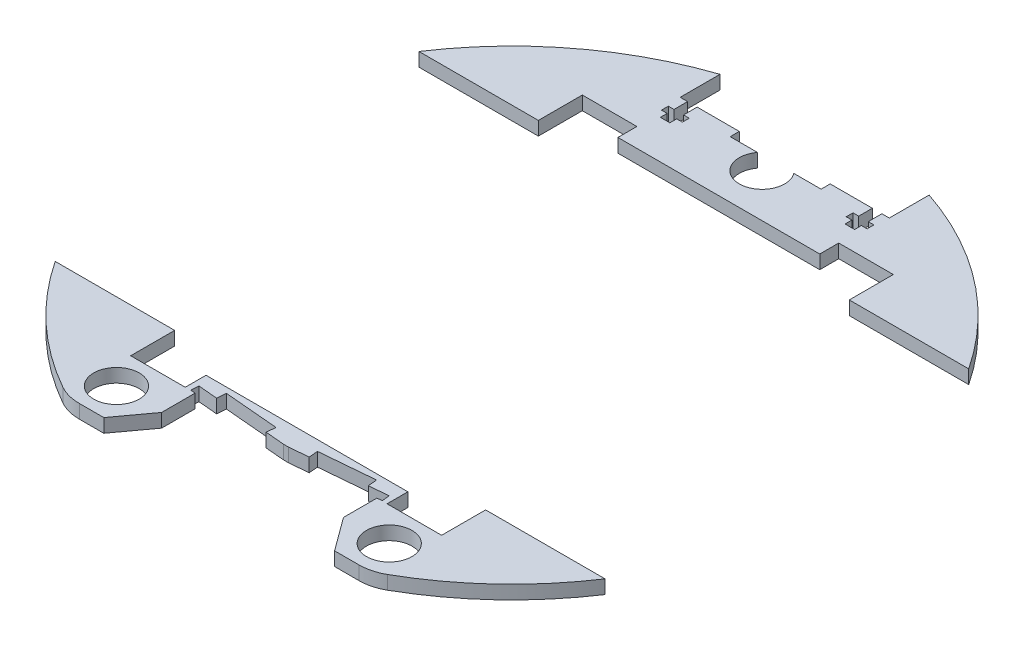
from build123d import *

# Parameters (mm, degrees)
BOSS_EXTRUDE1_DEPTH = 3
CUT_EXTRUDE1_DEPTH  = 103.574363269
SKETCH3_W           = 38.3
SKETCH3_H           = 80
CUT_EXTRUDE2_DEPTH  = 103.574363269
CUT_EXTRUDE3_DEPTH  = 95.453692358
SKETCH5_W           = 40
SKETCH5_H           = 14.693066202
CUT_EXTRUDE4_DEPTH  = 95.453692358
CUT_EXTRUDE5_DEPTH  = 95.453692358
SKETCH7_R           = 5
CUT_EXTRUDE6_DEPTH  = 92.610588908
SKETCH9_W           = 4.6
SKETCH9_H           = 1.5
CUT_EXTRUDE8_DEPTH  = 92.610588908
SKETCH10_W          = 2.1
SKETCH10_H          = 3
SKETCH10_H_2        = 1.5
CUT_EXTRUDE9_DEPTH  = 92.610588908
SKETCH11_R          = 5
CUT_EXTRUDE10_DEPTH = 92.610588908
CUT_EXTRUDE11_DEPTH = 92.610588908


with BuildPart() as part:
    # Sketch1 → Boss-Extrude1 (new body)
    with BuildSketch(Plane(origin=(0, 0, 0), x_dir=(1, 0, 0), z_dir=(0, 1, 0))):
        with BuildLine():
            Line((-30.763446914, -64.404598464), (30.763446914, -64.404598464))
            ThreePointArc((30.763446914, -64.404598464), (33.308308644, -64.075362589), (35.68559842, -63.109334218))
            ThreePointArc((35.68559842, -63.109334218), (0, 72.5), (-35.68559842, -63.109334218))
            ThreePointArc((-35.68559842, -63.109334218), (-33.308308644, -64.075362589), (-30.763446914, -64.404598464))
        make_face()
    extrude(amount=BOSS_EXTRUDE1_DEPTH)

    # Sketch2 → Cut-Extrude1 (cut, through all)
    with BuildSketch(Plane(origin=(0, 3, 0), x_dir=(1, 0, 0), z_dir=(0, 1, 0))):
        Polygon((22.2, -45.1), (22.2, -49.675685802), (34.2, -49.675685802), (34.2, 49.675685802), (22.2, 49.675685802), (22.2, 45.5), (-22.2, 45.5), (-22.2, 49.675685802), (-34.2, 49.675685802), (-34.2, -49.675685802), (-22.2, -49.675685802), (-22.2, -45.1), align=None)
    extrude(amount=-CUT_EXTRUDE1_DEPTH, mode=Mode.SUBTRACT)

    # Sketch3 → Cut-Extrude2 (cut, through all)
    with BuildSketch(Plane(origin=(0, 3, 0), x_dir=(1, 0, 0), z_dir=(0, 1, 0))):
        with Locations((-53.35, 0)):
            Rectangle(SKETCH3_W, SKETCH3_H)
        with Locations((53.35, 0)):
            Rectangle(SKETCH3_W, SKETCH3_H)
    extrude(amount=-CUT_EXTRUDE2_DEPTH, mode=Mode.SUBTRACT)


with BuildPart() as cut_extrude2_piece_1:
    # of the separate pieces the step leaves, piece 1, a body of its own (cut_extrude2_pieces)
    add(part.part.solids().sort_by_distance((60.466933112, 0, -40))[0])

    # Sketch6 → Cut-Extrude5 (cut, through all)
    with BuildSketch(Plane(origin=(0, 3, 0), x_dir=(1, 0, 0), z_dir=(0, 1, 0))):
        Polygon((-23, 72.5), (23, 72.5), (23, 60), (10, 60), (10, 58), (-10, 58), (-10, 60), (-23, 60), align=None)
    extrude(amount=-CUT_EXTRUDE5_DEPTH, mode=Mode.SUBTRACT)

    # Sketch9 → Cut-Extrude8 (cut, through all)
    with BuildSketch(Plane(origin=(0, 3, 0), x_dir=(1, 0, 0), z_dir=(0, 1, 0))):
        with Locations((20.32, 56.25)):
            Rectangle(SKETCH9_W, SKETCH9_H)
        with Locations((-20.32, 56.25)):
            Rectangle(SKETCH9_W, SKETCH9_H)
    extrude(amount=-CUT_EXTRUDE8_DEPTH, mode=Mode.SUBTRACT)

    # Sketch10 → Cut-Extrude9 (cut, through all)
    with BuildSketch(Plane(origin=(0, 3, 0), x_dir=(1, 0, 0), z_dir=(0, 1, 0))):
        with Locations((20.32, 58.5)):
            Rectangle(SKETCH10_W, SKETCH10_H)
        with Locations((20.32, 54.75)):
            Rectangle(SKETCH10_W, SKETCH10_H_2)
        with Locations((-20.32, 54.75)):
            Rectangle(SKETCH10_W, SKETCH10_H_2)
        with Locations((-20.32, 58.5)):
            Rectangle(SKETCH10_W, SKETCH10_H)
    extrude(amount=-CUT_EXTRUDE9_DEPTH, mode=Mode.SUBTRACT)

    # Sketch11 → Cut-Extrude10 (cut, through all)
    with BuildSketch(Plane(origin=(0, 3, 0), x_dir=(1, 0, 0), z_dir=(0, 1, 0))):
        with Locations((0, 55)):
            Circle(SKETCH11_R)
    extrude(amount=-CUT_EXTRUDE10_DEPTH, mode=Mode.SUBTRACT)


with BuildPart() as cut_extrude2_piece_2:
    # of the separate pieces the step leaves, piece 2, a body of its own (cut_extrude2_pieces)
    add(part.part.solids().sort_by_distance((-35.68559842, 0, 63.109334218))[0])

    # Sketch4 → Cut-Extrude3 (cut, through all)
    with BuildSketch(Plane(origin=(0, 3, 0), x_dir=(1, 0, 0), z_dir=(0, 1, 0))):
        Polygon((-21.070156074, -49.617905737), (-0.648164763, -51.404598464), (-0.5, -49.711067477), (-20.921991311, -47.924374751), align=None)
        Polygon((21.070156074, -49.617905737), (20.921991311, -47.924374751), (0.5, -49.711067477), (0.648164763, -51.404598464), align=None)
    extrude(amount=-CUT_EXTRUDE3_DEPTH, mode=Mode.SUBTRACT)

    # Sketch5 → Cut-Extrude4 (cut, through all)
    with BuildSketch(Plane(origin=(0, 3, 0), x_dir=(1, 0, 0), z_dir=(0, 1, 0))):
        with Locations((0, -57.058065363)):
            Rectangle(SKETCH5_W, SKETCH5_H)
        Polygon((16.688163844, -48.294786657), (4.733827467, -49.34065557), (4.559515981, -47.348266174), (16.513852358, -46.302397261), align=None)
        Polygon((-16.513852358, -46.302397261), (-4.559515981, -47.348266174), (-4.733827467, -49.34065557), (-16.688163844, -48.294786657), align=None)
    extrude(amount=-CUT_EXTRUDE4_DEPTH, mode=Mode.SUBTRACT)

    # Sketch7 → Cut-Extrude6 (cut, through all)
    with BuildSketch(Plane(origin=(0, 3, 0), x_dir=(1, 0, 0), z_dir=(0, 1, 0))):
        with Locations((-30, -57)):
            Circle(SKETCH7_R)
        with Locations((30, -57)):
            Circle(SKETCH7_R)
    extrude(amount=-CUT_EXTRUDE6_DEPTH, mode=Mode.SUBTRACT)

    # Sketch13 → Cut-Extrude11 (cut, through all)
    with BuildSketch(Plane(origin=(0, 3, 0), x_dir=(1, 0, 0), z_dir=(0, 1, 0))):
        Polygon((20, -57.058065363), (25.381723457, -64.404598464), (20, -64.404598464), align=None)
        Polygon((-20, -64.404598464), (-20, -57.058065363), (-25.381723457, -64.404598464), align=None)
    extrude(amount=-CUT_EXTRUDE11_DEPTH, mode=Mode.SUBTRACT)


solid = Compound([cut_extrude2_piece_1.part, cut_extrude2_piece_2.part])
